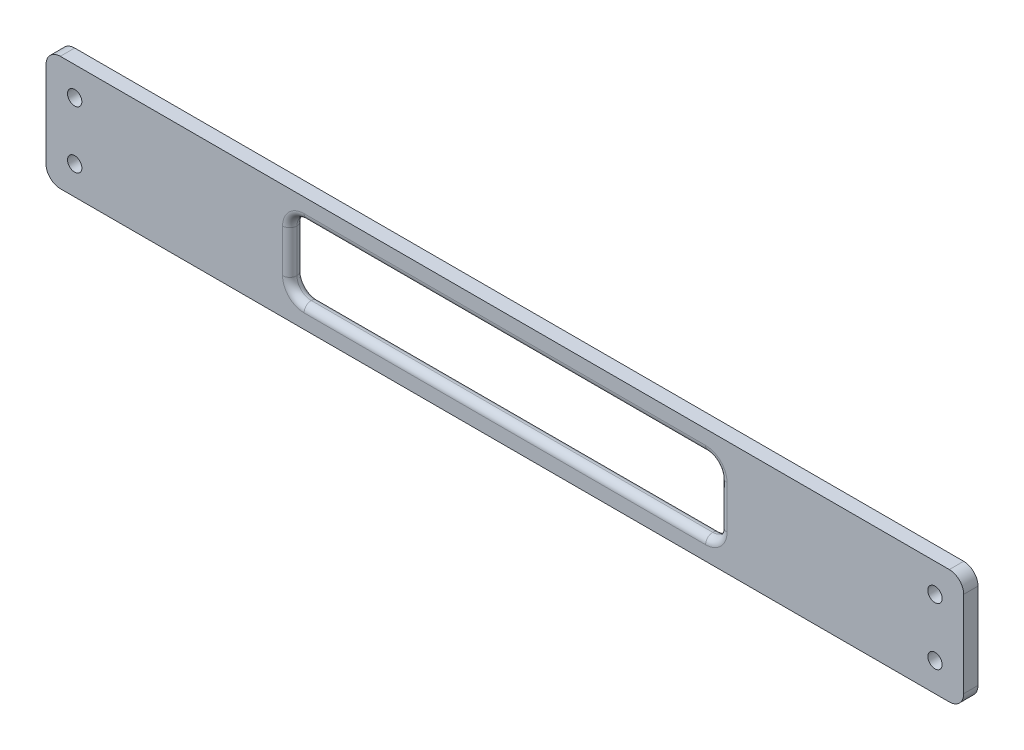
from build123d import *

# Parameters (mm, degrees)
SKETCH1_W           = 406.4
SKETCH1_H           = 50.8
BOSS_EXTRUDE1_DEPTH = 6.35
CUT_EXTRUDE1_DEPTH  = 6.35
FILLET1_R           = 6.35
SKETCH3_R           = 3.175
CUT_EXTRUDE2_DEPTH  = 6.35
FILLET3_R           = 3.175


with BuildPart() as part:
    # Sketch1 → Boss-Extrude1 (new body)
    with BuildSketch(Plane.XY):
        Rectangle(SKETCH1_W, SKETCH1_H)
    extrude(amount=BOSS_EXTRUDE1_DEPTH)

    # Sketch2 → Cut-Extrude1 (cut)
    with BuildSketch(Plane.XY.offset(6.35)):
        with BuildLine():
            Line((-88.9, -15.875), (88.9, -15.875))
            ThreePointArc((88.9, -15.875), (93.390128061, -14.015128061), (95.25, -9.525))
            Line((95.25, -9.525), (95.25, 9.525))
            ThreePointArc((95.25, 9.525), (93.390128061, 14.015128061), (88.9, 15.875))
            Line((88.9, 15.875), (-88.9, 15.875))
            ThreePointArc((-88.9, 15.875), (-93.390128061, 14.015128061), (-95.25, 9.525))
            Line((-95.25, 9.525), (-95.25, -9.525))
            ThreePointArc((-95.25, -9.525), (-93.390128061, -14.015128061), (-88.9, -15.875))
        make_face()
    extrude(amount=-CUT_EXTRUDE1_DEPTH, mode=Mode.SUBTRACT)

    # Fillet1
    fillet1_edges = [part.edges().sort_by_distance(p)[0] for p in [
        (203.2, -25.4, 3.175),
        (-203.2, -25.4, 3.175),
        (-203.2, 25.4, 3.175),
        (203.2, 25.4, 3.175),
    ]]
    fillet(fillet1_edges, radius=FILLET1_R)

    # Sketch3 → Cut-Extrude2 (cut)
    with BuildSketch(Plane.XY.offset(6.35)):
        with Locations((-190.5, 12.7)):
            Circle(SKETCH3_R)
        with Locations((-190.5, -12.7)):
            Circle(SKETCH3_R)
        with Locations(Location((190.5, -12.7, 0), (0, 0, 180))):
            Circle(SKETCH3_R)
        with Locations(Location((190.5, 12.7, 0), (0, 0, 180))):
            Circle(SKETCH3_R)
    extrude(amount=-CUT_EXTRUDE2_DEPTH, mode=Mode.SUBTRACT)

    # Fillet3
    fillet3_edges = [part.edges().sort_by_distance(p)[0] for p in [
        (-93.390128061, -14.015128061, 0),
        (-95.25, 0, 0),
        (-93.390128061, 14.015128061, 0),
        (0, 15.875, 0),
        (93.390128061, 14.015128061, 0),
        (95.25, 0, 0),
        (93.390128061, -14.015128061, 0),
        (-93.390128061, -14.015128061, 6.35),
        (-95.25, 0, 6.35),
        (-93.390128061, 14.015128061, 6.35),
        (0, 15.875, 6.35),
        (93.390128061, 14.015128061, 6.35),
        (95.25, 0, 6.35),
        (93.390128061, -14.015128061, 6.35),
        (0, -15.875, 0),
        (0, -15.875, 6.35),
    ]]
    fillet(fillet3_edges, radius=FILLET3_R - 0.0001)  # a hair under: the kernel refuses the full size


solid = part.part
